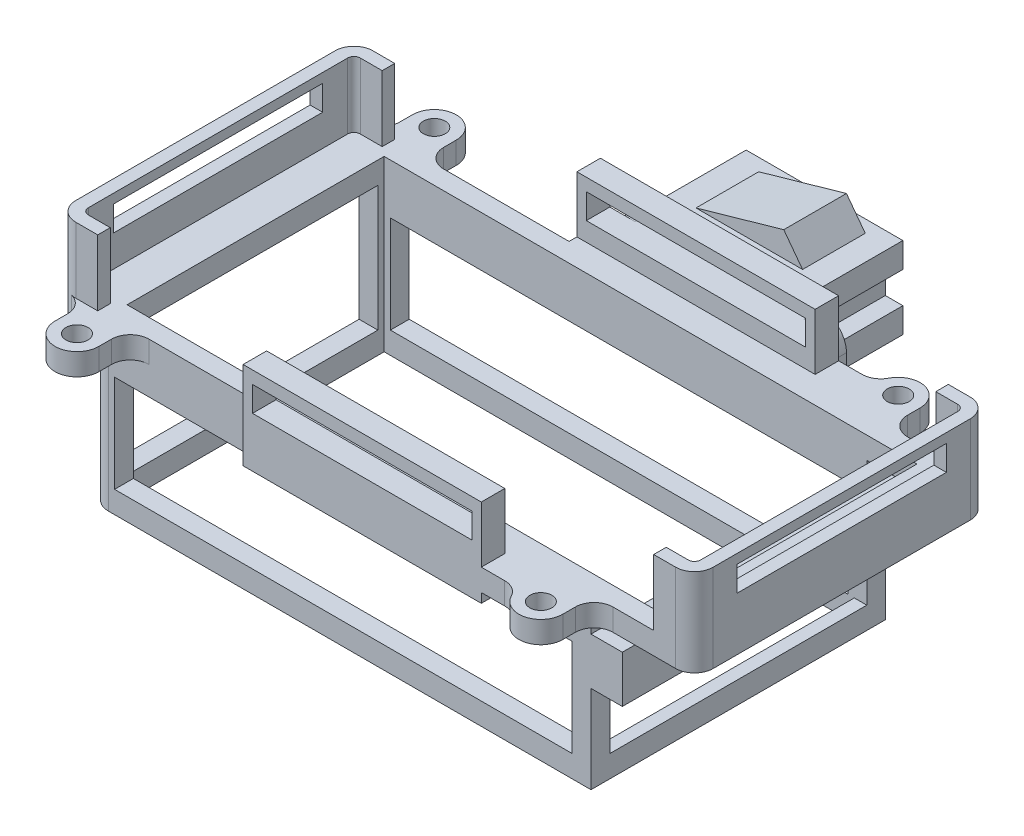
from build123d import *

# Parameters (mm, degrees)
SKETCH_1_W          = 80
SKETCH_1_H          = 47
EXTRUDE_1_DEPTH     = 23.5
EXTRUDE_2_DEPTH     = 3.5
SKETCH_19_R         = 1.75
CUT_EXTRUDE_7_DEPTH = 71.322471515
FILLET_2_R          = 3
SKETCH_3_W          = 85
SKETCH_3_H          = 41
CUT_EXTRUDE_1_DEPTH = 23.5
SKETCH_4_W          = 75
SKETCH_4_H          = 41
CUT_EXTRUDE_2_DEPTH = 4
SKETCH_5_W          = 73
SKETCH_5_H          = 15.5
CUT_EXTRUDE_3_DEPTH = 84.674966388
SKETCH_6_W          = 39
SKETCH_6_H          = 20
CUT_EXTRUDE_4_DEPTH = 4
EXTRUDE_3_REACH     = 89.072
SKETCH_9_W          = 38
SKETCH_9_H          = 5
SKETCH_10_W         = 38
SKETCH_10_H         = 9
EXTRUDE_4_DEPTH     = 3.75
SKETCH_11_W         = 35
SKETCH_11_H         = 4
CUT_EXTRUDE_5_DEPTH = 3.75
FILLET_3_R          = 3
FILLET_4_R          = 3
EXTRUDE_START       = 10.5
EXTRUDE_5_DEPTH     = 10.5
SKETCH_13_W         = 33.381049962
SKETCH_13_H         = 4
CUT_EXTRUDE_6_DEPTH = 113.838380057
SKETCH_14_W         = 47
SKETCH_14_H         = 7.5
EXTRUDE_6_DEPTH     = 5
SKETCH_15_W         = 35
SKETCH_15_H         = 11
EXTRUDE_7_DEPTH     = 2.75
SKETCH_16_W         = 25
SKETCH_16_H         = 13
EXTRUDE_8_DEPTH     = 14
SKETCH_21_W         = 2.8
SKETCH_21_H         = 5
CUT_EXTRUDE_8_DEPTH = 14
SKETCH_20_R         = 2.35
EXTRUDE_10_DEPTH    = 1
FILLET_5_R          = 4
EXTRUDE_START_2     = -2
EXTRUDE_9_DEPTH     = 10


with BuildPart() as part:
    # 草图1 → 凸台-拉伸1 (new body)
    with BuildSketch(Plane(origin=(0, 0, 0), x_dir=(1, 0, 0), z_dir=(0, 1, 0))):
        Rectangle(SKETCH_1_W, SKETCH_1_H)
    extrude(amount=EXTRUDE_1_DEPTH)

    # 草图2 → 凸台-拉伸2 (add)
    with BuildSketch(Plane(origin=(0, 23.5, 0), x_dir=(1, 0, 0), z_dir=(0, 1, 0))):
        with BuildLine():
            Line((-10.5, -28.5), (33.5, -28.5))
            ThreePointArc((33.5, -28.5), (37, -32), (40.5, -28.5))
            Line((40.5, -28.5), (40.5, -23.5))
            Line((40.5, -23.5), (56.5, -23.5))
            Line((56.5, -23.5), (56.5, 23.5))
            Line((56.5, 23.5), (40.5, 23.5))
            Line((40.5, 23.5), (40.5, 28.5))
            ThreePointArc((40.5, 28.5), (37, 32), (33.5, 28.5))
            Line((33.5, 28.5), (-10.5, 28.5))
            Line((-10.5, 28.5), (-10.5, 23.5))
            Line((-10.5, 23.5), (-33.5, 23.5))
            Line((-33.5, 23.5), (-33.5, 28.5))
            ThreePointArc((-33.5, 28.5), (-37, 32), (-40.5, 28.5))
            Line((-40.5, 28.5), (-40.5, 23.5))
            Line((-40.5, 23.5), (-45, 23.5))
            Line((-45, 23.5), (-45, -23.5))
            Line((-45, -23.5), (-40.5, -23.5))
            Line((-40.5, -23.5), (-40.5, -28.5))
            ThreePointArc((-40.5, -28.5), (-37, -32), (-33.5, -28.5))
            Line((-33.5, -28.5), (-33.5, -23.5))
            Line((-33.5, -23.5), (-10.5, -23.5))
            Line((-10.5, -23.5), (-10.5, -28.5))
        make_face()
    extrude(amount=EXTRUDE_2_DEPTH)

    # 草图19 → 切除-拉伸7 (cut, through all)
    with BuildSketch(Plane(origin=(0, 27, 0), x_dir=(1, 0, 0), z_dir=(0, 1, 0))):
        with Locations(Location((-37, 28.5, 0), (0, 0, 270))):
            Circle(SKETCH_19_R)
        with Locations(Location((37, 28.5, 0), (0, 0, 270))):
            Circle(SKETCH_19_R)
        with Locations(Location((37, -28.5, 0), (0, 0, 270))):
            Circle(SKETCH_19_R)
        with Locations(Location((-37, -28.5, 0), (0, 0, 270))):
            Circle(SKETCH_19_R)
    extrude(amount=-CUT_EXTRUDE_7_DEPTH, mode=Mode.SUBTRACT)

    # 圆角2
    fillet_2_edges = [part.edges().sort_by_distance(p)[0] for p in [
        (-40, 11.75, -23.5),
        (-40, 11.75, 23.5),
    ]]
    fillet(fillet_2_edges, radius=FILLET_2_R)

    # 草图3 → 切除-拉伸1 (cut)
    with BuildSketch(Plane(origin=(0, 27, 0), x_dir=(1, 0, 0), z_dir=(0, 1, 0))):
        with Locations((5.5, 0)):
            Rectangle(SKETCH_3_W, SKETCH_3_H)
    extrude(amount=-CUT_EXTRUDE_1_DEPTH, mode=Mode.SUBTRACT)

    # 草图4 → 切除-拉伸2 (cut)
    with BuildSketch(Plane.XZ):
        with Locations((0.5, 0)):
            Rectangle(SKETCH_4_W, SKETCH_4_H)
    extrude(amount=-CUT_EXTRUDE_2_DEPTH, mode=Mode.SUBTRACT)

    # 草图5 → 切除-拉伸3 (cut, through all)
    with BuildSketch(Plane.XY.offset(23.5)):
        with Locations((0.5, 11.25)):
            Rectangle(SKETCH_5_W, SKETCH_5_H)
    extrude(amount=-CUT_EXTRUDE_3_DEPTH, mode=Mode.SUBTRACT)

    # 草图6 → 切除-拉伸4 (cut)
    with BuildSketch(Plane.ZY.offset(40)):
        with Locations((0, 13.5)):
            Rectangle(SKETCH_6_W, SKETCH_6_H)
    extrude(amount=-CUT_EXTRUDE_4_DEPTH, mode=Mode.SUBTRACT)

    # 草图9 → 凸台-拉伸3 (add, up to next)
    with BuildSketch(Plane.XY.offset(28.5), mode=Mode.PRIVATE) as extrude_3_sk1:
        with Locations((8.5, 24.5)):
            Rectangle(SKETCH_9_W, SKETCH_9_H)
    extrude_3_tool1 = extrude(extrude_3_sk1.sketch, amount=-EXTRUDE_3_REACH, mode=Mode.PRIVATE) - part.part
    extrude_3 = extrude_3_tool1.solids().sort_by_distance((8.5, 24.5, 28.5))[0]
    add(extrude_3)

    # 草图10 → 凸台-拉伸4 (add)
    with BuildSketch(Plane.XY.offset(28.5)):
        with Locations((8.5, 31.5)):
            Rectangle(SKETCH_10_W, SKETCH_10_H)
    extrude_4 = extrude(amount=-EXTRUDE_4_DEPTH)

    # 草图11 → 切除-拉伸5 (cut)
    with BuildSketch(Plane.XY.offset(28.5)):
        with Locations((8.5, 32)):
            Rectangle(SKETCH_11_W, SKETCH_11_H)
    cut_extrude_5 = extrude(amount=-CUT_EXTRUDE_5_DEPTH, mode=Mode.SUBTRACT)

    # 镜向1: 凸台-拉伸3, 凸台-拉伸4, 切除-拉伸5 across plane
    add(extrude_3.mirror(Plane.XY))
    add(extrude_4.mirror(Plane.XY))
    add(cut_extrude_5.mirror(Plane.XY), mode=Mode.SUBTRACT)

    # 圆角3
    fillet_3_edges = [part.edges().sort_by_distance(p)[0] for p in [
        (33.5, 25.25, 28.5),
        (-40.5, 25.25, 23.5),
        (40.5, 25.25, -23.5),
        (33.5, 25.25, -28.5),
        (-33.5, 25.25, -23.5),
        (-33.5, 25.25, 23.5),
        (40.5, 25.25, 23.5),
        (-40.5, 25.25, -23.5),
    ]]
    fillet(fillet_3_edges, radius=FILLET_3_R)

    # 圆角4
    fillet_4_edges = [part.edges().sort_by_distance(p)[0] for p in [
        (56.5, 25.25, 23.5),
        (56.5, 25.25, -23.5),
        (-45, 25.25, -23.5),
        (-45, 25.25, 23.5),
    ]]
    fillet(fillet_4_edges, radius=FILLET_4_R)

    # 草图12 → 凸台-拉伸5 (add)
    with BuildSketch(Plane(origin=(0, 27, 0), x_dir=(1, 0, 0), z_dir=(0, 1, 0)).offset(EXTRUDE_START)):
        with BuildLine():
            Line((-45, 20.690524981), (-45, -20.690524981))
            ThreePointArc((-45, -20.690524981), (-44.121320344, -22.811845324), (-42, -23.690524981))
            Line((-42, -23.690524981), (-38.5, -23.690524981))
            Line((-38.5, -23.690524981), (-38.5, -21.690524981))
            Line((-38.5, -21.690524981), (-42, -21.690524981))
            ThreePointArc((-42, -21.690524981), (-42.707106781, -21.397631762), (-43, -20.690524981))
            Line((-43, -20.690524981), (-43, 20.690524981))
            ThreePointArc((-43, 20.690524981), (-42.707106781, 21.397631762), (-42, 21.690524981))
            Line((-42, 21.690524981), (-38.5, 21.690524981))
            Line((-38.5, 21.690524981), (-38.5, 23.690524981))
            Line((-38.5, 23.690524981), (-42, 23.690524981))
            ThreePointArc((-42, 23.690524981), (-44.121320344, 22.811845324), (-45, 20.690524981))
        make_face()
        with BuildLine():
            Line((53.5, 23.5), (50, 23.5))
            Line((50, 23.5), (50, 21.5))
            Line((50, 21.5), (53.5, 21.5))
            ThreePointArc((53.5, 21.5), (54.207106781, 21.207106781), (54.5, 20.5))
            Line((54.5, 20.5), (54.5, -20.5))
            ThreePointArc((54.5, -20.5), (54.207106781, -21.207106781), (53.5, -21.5))
            Line((53.5, -21.5), (50, -21.5))
            Line((50, -21.5), (50, -23.5))
            Line((50, -23.5), (53.5, -23.5))
            ThreePointArc((53.5, -23.5), (55.621320344, -22.621320344), (56.5, -20.5))
            Line((56.5, -20.5), (56.5, 20.5))
            ThreePointArc((56.5, 20.5), (55.621320344, 22.621320344), (53.5, 23.5))
        make_face()
    extrude(amount=-EXTRUDE_5_DEPTH)

    # 草图13 → 切除-拉伸6 (cut, through all)
    with BuildSketch(Plane.ZY.offset(45)):
        with Locations((0, 34)):
            Rectangle(SKETCH_13_W, SKETCH_13_H)
    extrude(amount=-CUT_EXTRUDE_6_DEPTH, mode=Mode.SUBTRACT)

    # 草图14 → 凸台-拉伸6 (add)
    with BuildSketch(Plane(origin=(40, 0, 0), x_dir=(0, 0, -1), z_dir=(1, 0, 0))):
        with Locations((0, 17.75)):
            Rectangle(SKETCH_14_W, SKETCH_14_H)
    extrude(amount=EXTRUDE_6_DEPTH)

    # 草图15 → 凸台-拉伸7 (add)
    with BuildSketch(Plane.XY.offset(-28.5)):
        with Locations((8.5, 24.5)):
            Rectangle(SKETCH_15_W, SKETCH_15_H)
    extrude(amount=-EXTRUDE_7_DEPTH)

    # 草图16 → 凸台-拉伸8 (add)
    with BuildSketch(Plane(origin=(0, 0, -31.25), x_dir=(-1, 0, 0), z_dir=(0, 0, -1))):
        with Locations((-8.5, 25.5)):
            Rectangle(SKETCH_16_W, SKETCH_16_H)
    extrude(amount=EXTRUDE_8_DEPTH)

    # 草图21 → 切除-拉伸8 (cut)
    with BuildSketch(Plane(origin=(0, 0, -45.25), x_dir=(-1, 0, 0), z_dir=(0, 0, -1))):
        with Locations((-19.6, 25.5)):
            Rectangle(SKETCH_21_W, SKETCH_21_H)
        with Locations((2.6, 25.5)):
            Rectangle(SKETCH_21_W, SKETCH_21_H)
    extrude(amount=-CUT_EXTRUDE_8_DEPTH, mode=Mode.SUBTRACT)

    # 草图20 → 凸台-拉伸10 (add)
    with BuildSketch(Plane(origin=(0, 0, -31.25), x_dir=(-1, 0, 0), z_dir=(0, 0, -1))):
        with Locations((-22.5, 24.5)):
            Circle(SKETCH_20_R)
        with Locations((5.5, 24.5)):
            Circle(SKETCH_20_R)
    extrude(amount=EXTRUDE_10_DEPTH)

    # 圆角5
    # the kernel refuses this fillet: 4 mm, written as the material it takes off along each edge
    with BuildSketch(Plane(origin=(26, 19, -28.5), x_dir=(-1, 0, 0), z_dir=(0, 0, -1)), Plane(origin=(-9, 30, -28.5), x_dir=(1, 0, 0), z_dir=(0, 0, -1))) as fillet_5_piece_1:
        with BuildLine():
            CenterArc((FILLET_5_R, FILLET_5_R), FILLET_5_R, 180, 90)
            Line((0, FILLET_5_R), (0, 0))
            Line((0, 0), (FILLET_5_R, 0))
        make_face()
    extrude(amount=12.75, mode=Mode.SUBTRACT)
    with BuildSketch(Plane(origin=(26, 30, -28.5), x_dir=(-1, 0, 0), z_dir=(0, 0, -1)), Plane(origin=(-9, 19, -28.5), x_dir=(1, 0, 0), z_dir=(0, 0, -1))) as fillet_5_piece_2:
        with BuildLine():
            CenterArc((FILLET_5_R, -FILLET_5_R), FILLET_5_R, 90, 90)
            Line((0, -FILLET_5_R), (0, 0))
            Line((0, 0), (FILLET_5_R, 0))
        make_face()
    extrude(amount=12.75, mode=Mode.SUBTRACT)

    # 草图17 → 凸台-拉伸9 (add)
    with BuildSketch(Plane(origin=(0, 0, -45.25), x_dir=(-1, 0, 0), z_dir=(0, 0, -1)).offset(EXTRUDE_START_2)):
        Polygon((-17, 32), (-14, 36), (0, 32), align=None)
    extrude(amount=-EXTRUDE_9_DEPTH)


solid = part.part
